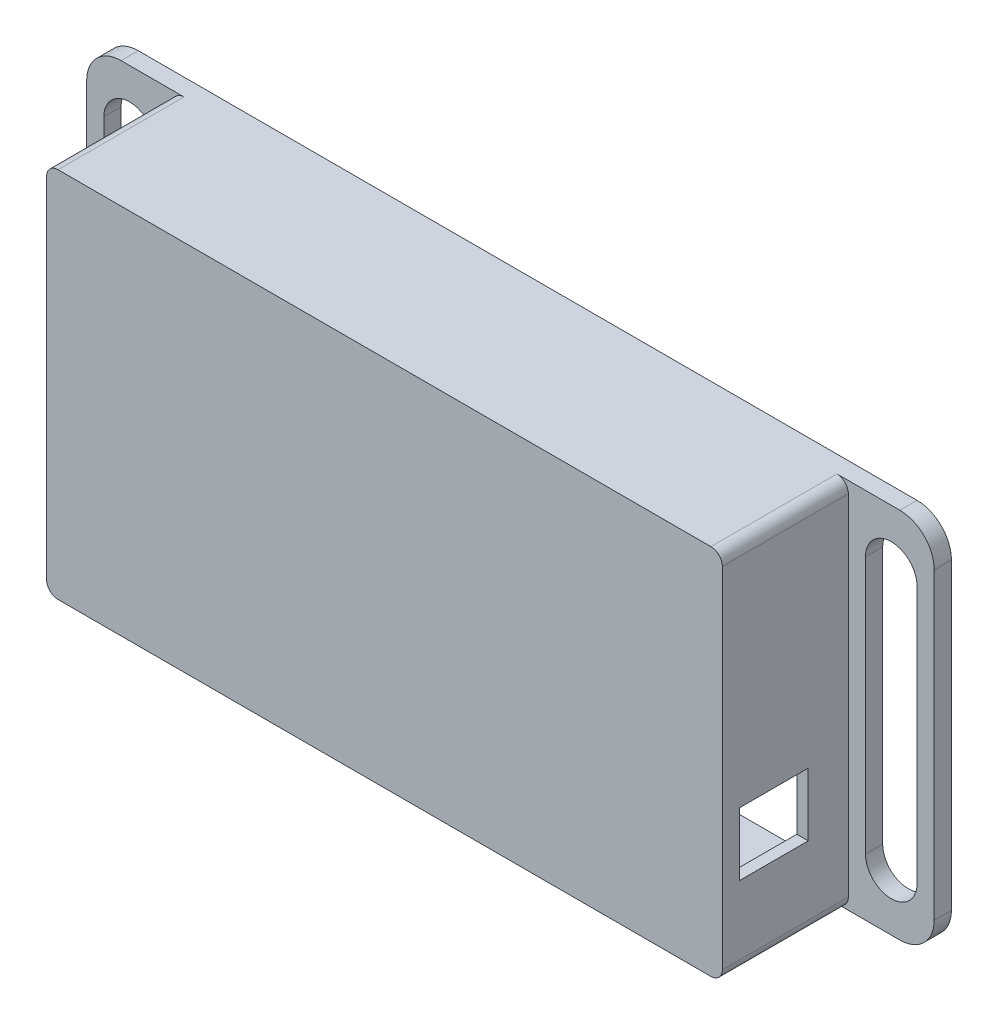
from build123d import *

# Parameters (mm, degrees)
SKETCH2_W            = 118
SKETCH2_H            = 65
BOSS_EXTRUDE2_DEPTH  = 2
SKETCH4_W            = 118
SKETCH4_H            = 65
SKETCH4_W_2          = 114
SKETCH4_H_2          = 61
BOSS_EXTRUDE3_DEPTH  = 23
SKETCH6_W            = 15
SKETCH6_H            = 65
BOSS_EXTRUDE4_DEPTH  = 3
FILLET1_R            = 6
FILLET1_OF_MIRROR1_R = 6
FILLET2_R            = 2
FILLET3_R            = 1
SKETCH7_W            = 12
SKETCH7_H            = 11
CUT_EXTRUDE1_DEPTH   = 10


with BuildPart() as part:
    # Sketch2 → Boss-Extrude2 (new body)
    with BuildSketch(Plane.XY):
        Rectangle(SKETCH2_W, SKETCH2_H)
    extrude(amount=BOSS_EXTRUDE2_DEPTH)

    # Sketch4 → Boss-Extrude3 (add)
    with BuildSketch(Plane.XY):
        Rectangle(SKETCH4_W, SKETCH4_H)
        Rectangle(SKETCH4_W_2, SKETCH4_H_2, mode=Mode.SUBTRACT)
    extrude(amount=-BOSS_EXTRUDE3_DEPTH)

    # Sketch6 → Boss-Extrude4 (add)
    with BuildSketch(Plane(origin=(0, 0, -23), x_dir=(-1, 0, 0), z_dir=(0, 0, -1))):
        with Locations((66.5, 0)):
            Rectangle(SKETCH6_W, SKETCH6_H)
        with BuildLine():
            Line((62, -22.5), (62, 22.5))
            ThreePointArc((62, 22.5), (66.5, 27), (71, 22.5))
            Line((71, 22.5), (71, -22.5))
            ThreePointArc((71, -22.5), (66.5, -27), (62, -22.5))
        make_face(mode=Mode.SUBTRACT)
    boss_extrude4 = extrude(amount=-BOSS_EXTRUDE4_DEPTH)

    # Fillet1
    fillet1_edges = [part.edges().sort_by_distance(p)[0] for p in [
        (-74, -32.5, -21.5),
        (-74, 32.5, -21.5),
    ]]
    fillet(fillet1_edges, radius=FILLET1_R)

    # Mirror1: Boss-Extrude4 across plane
    add(boss_extrude4.mirror(Plane(origin=(0, 0, 0), x_dir=(0, 0, 1), z_dir=(1, 0, 0))))

    # Fillet1 of Mirror1
    fillet1_of_mirror1_edges = [part.edges().sort_by_distance(p)[0] for p in [
        (74, -32.5, -21.5),
        (74, 32.5, -21.5),
    ]]
    fillet(fillet1_of_mirror1_edges, radius=FILLET1_OF_MIRROR1_R)

    # Fillet2
    fillet2_edges = [part.edges().sort_by_distance(p)[0] for p in [
        (-59, 32.5, -9),
        (-59, -32.5, -9),
        (59, 32.5, -9),
        (59, -32.5, -9),
    ]]
    fillet(fillet2_edges, radius=FILLET2_R)

    # Fillet3
    fillet3_edges = [part.edges().sort_by_distance(p)[0] for p in [
        (-57, -30.5, -11.5),
        (-57, 30.5, -11.5),
        (57, 30.5, -11.5),
        (57, -30.5, -11.5),
    ]]
    fillet(fillet3_edges, radius=FILLET3_R)

    # Sketch7 → Cut-Extrude1 (cut)
    with BuildSketch(Plane(origin=(59, 0, 0), x_dir=(0, 0, -1), z_dir=(1, 0, 0))):
        with Locations((7, -13)):
            Rectangle(SKETCH7_W, SKETCH7_H)
    extrude(amount=-CUT_EXTRUDE1_DEPTH, mode=Mode.SUBTRACT)


solid = part.part
